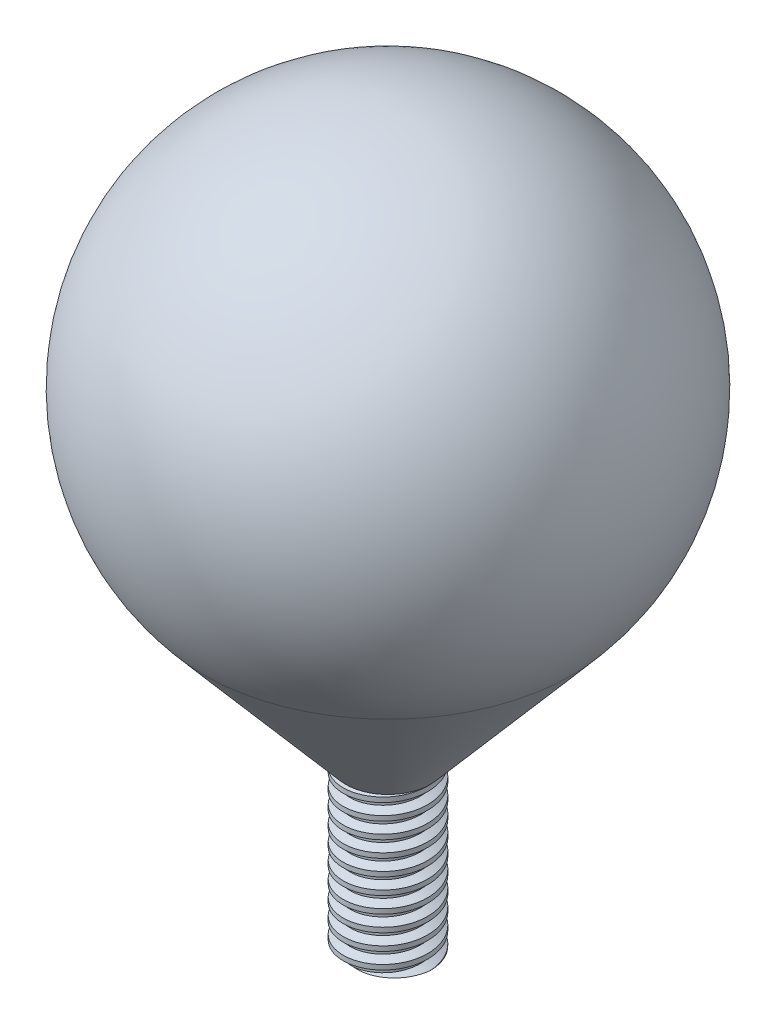
from build123d import *

# Parameters (mm, degrees)
THREAD2_PITCH = 1


with BuildPart() as part:
    # Sketch1 → Revolve1 (revolve)
    with BuildSketch(Plane.XY, mode=Mode.PRIVATE) as revolve1_sk:
        with BuildLine():
            Line((-2.625, -20), (-2.625, -30))
            Line((-2.625, -30), (0, -30))
            Line((0, -30), (0, 15))
            ThreePointArc((0, 15), (-13.625629439, 6.272337873), (-11.395273543, -9.754370347))
            Line((-11.395273543, -9.754370347), (-2.625, -20))
        make_face()
    revolve(revolve1_sk.sketch.rotate(Axis((0, -260.464421806, 0), (0, 1, 0)), 180), axis=Axis((0, -260.464421806, 0), (0, 1, 0)))

    # Thread2: the profile of Thread Profile2 profile screwed along a right-hand helix of 11 turns, 8 arcs to a turn; built about Z, then put on its axis
    thread2_z = Axis((0, 0, 0), (0, 0, 1))
    thread2_corners = [(2.6253, 0, -0.000173205), (2.6253, 0, 0.700173203), (2.1919873, 0, 0.449999999), (2.1919873, 0, 0.249999999)]
    with BuildLine(mode=Mode.PRIVATE) as thread2_profile:
        Line(thread2_corners[0], thread2_corners[1])
        Line(thread2_corners[1], thread2_corners[2])
        Line(thread2_corners[2], thread2_corners[3])
        Line(thread2_corners[3], thread2_corners[0])
    thread2_cap = Face(thread2_profile.wire())
    thread2_turn_angles = [0, 22.5, 45, 67.5, 90, 112.5, 135, 157.5, 180, 202.5, 225, 247.5, 270, 292.5, 315, 337.5, 360]
    thread2_turn_weights = [1, 0.9238795325112867, 1, 0.9238795325112867, 1, 0.9238795325112867, 1, 0.9238795325112867, 1, 0.9238795325112867, 1, 0.9238795325112867, 1, 0.9238795325112867, 1, 0.9238795325112867, 1]
    thread2_turn_rails = [Edge.make_bspline([Vector(p[0], p[1], 0).rotate(thread2_z, thread2_turn_angles[k]) / thread2_turn_weights[k] + Vector(0, 0, p[2] + THREAD2_PITCH * thread2_turn_angles[k] / 360) for k in range(17)], [0, 0, 0, 1, 1, 2, 2, 3, 3, 4, 4, 5, 5, 6, 6, 7, 7, 8, 8, 8], 2, thread2_turn_weights) for p in thread2_corners]
    thread2_turn_sides = [Face.make_surface_from_curves(thread2_turn_rails[p[0]], thread2_turn_rails[p[1]]) for p in [(0, 1), (1, 2), (2, 3), (3, 0)]]
    thread2 = Plane(origin=(0, -31, 0), x_dir=(1, 0, 0), z_dir=(0, 1, 0)) * Solid(Shell([*[p.moved(Location((0, 0, THREAD2_PITCH * i))) for i in range(11) for p in thread2_turn_sides], thread2_cap, thread2_cap.rotate(thread2_z, 3960).moved(Location((0, 0, THREAD2_PITCH * 3960 / 360)))]))
    add(thread2, mode=Mode.SUBTRACT)


solid = part.part
